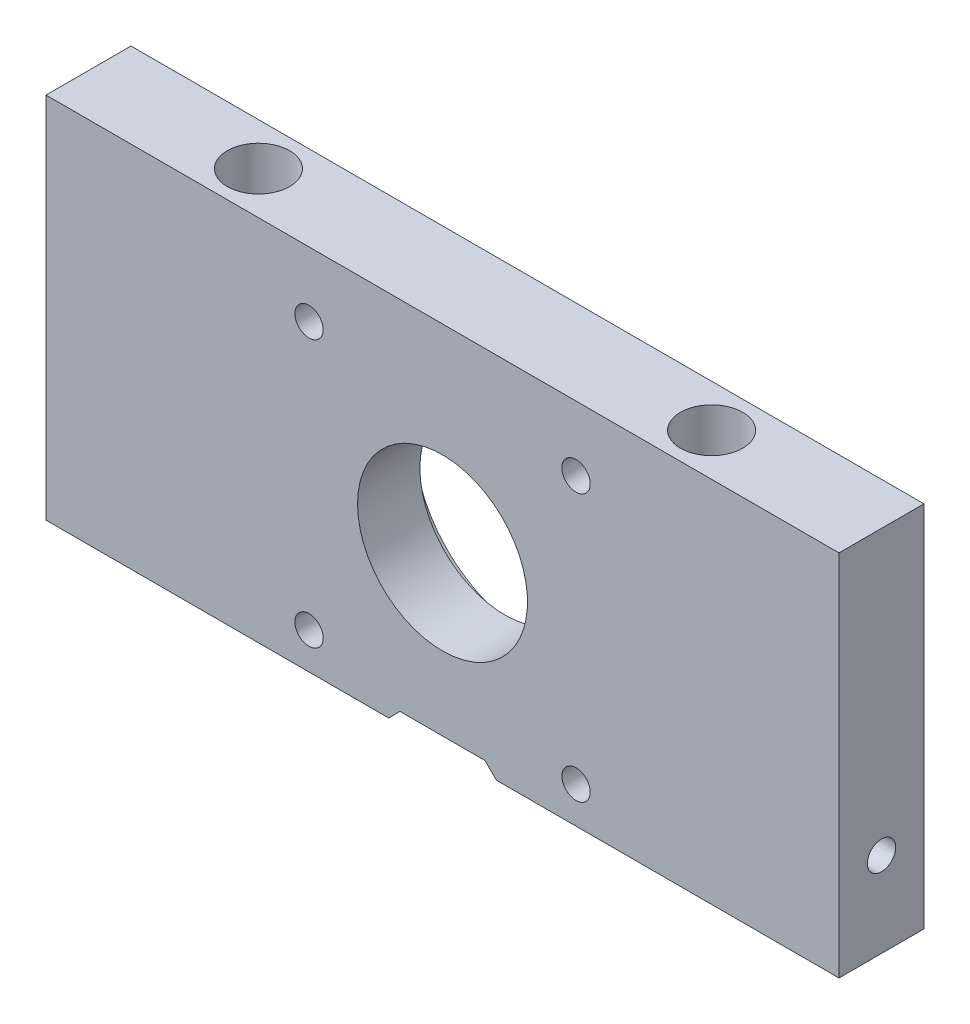
from build123d import *

# Parameters (mm, degrees)
SKETCH1_W                                           = 140
SKETCH1_H                                           = 65
BOSS_EXTRUDE1_DEPTH                                 = 15
SKETCH2_R                                           = 15
SKETCH2_R_2                                         = 2.5
CUT_EXTRUDE2_DEPTH                                  = 27
TAP_DRILL_FOR_M6_TAP1_D                             = 5
TAP_DRILL_FOR_M6_TAP1_DEPTH                         = 15
TAP_DRILL_FOR_M6_TAP1_TIP                           = 1.502151548
CBORE_FOR_M6_HEX_SOCKET_HEAD_CAP_SCREW3_D           = 6.6
CBORE_FOR_M6_HEX_SOCKET_HEAD_CAP_SCREW3_CBORE_D     = 11
CBORE_FOR_M6_HEX_SOCKET_HEAD_CAP_SCREW3_CBORE_DEPTH = 61.4
SKETCH29_W                                          = 35
SKETCH29_H                                          = 2
CUT_EXTRUDE6_DEPTH                                  = 79.620925968
CHAMFER2_SIZE                                       = 10
SKETCH30_R                                          = 20
CUT_EXTRUDE7_DEPTH                                  = 4


with BuildPart() as part:
    # Sketch1 → Boss-Extrude1 (new body)
    with BuildSketch(Plane.XY):
        Rectangle(SKETCH1_W, SKETCH1_H)
    extrude(amount=BOSS_EXTRUDE1_DEPTH)

    # Sketch2 → Cut-Extrude2 (cut)
    with BuildSketch(Plane(origin=(0, 0, 15), x_dir=(-1, 0, 0), z_dir=(0, 0, -1))):
        with Locations(Location((0, -2.5, 0), (0, 0, 180))):
            Circle(SKETCH2_R)
        with Locations(Location((-23.57, 21.07, 0), (0, 0, 180))):
            Circle(SKETCH2_R_2)
        with Locations(Location((23.57, 21.07, 0), (0, 0, 180))):
            Circle(SKETCH2_R_2)
        with Locations(Location((23.57, -26.07, 0), (0, 0, 180))):
            Circle(SKETCH2_R_2)
        with Locations(Location((-23.57, -26.07, 0), (0, 0, 180))):
            Circle(SKETCH2_R_2)
    extrude(amount=CUT_EXTRUDE2_DEPTH, mode=Mode.SUBTRACT)

    # Tap Drill for M6 Tap1
    with Locations(Plane(origin=(70, 0, 0), x_dir=(0, 0, -1), z_dir=(1, 0, 0))):
        with Locations((-7.5, -17.5)):
            Hole(TAP_DRILL_FOR_M6_TAP1_D / 2, depth=TAP_DRILL_FOR_M6_TAP1_DEPTH)
            with Locations((0, 0, -(TAP_DRILL_FOR_M6_TAP1_DEPTH + TAP_DRILL_FOR_M6_TAP1_TIP / 2))):  # 118° drill point
                Cone(0, TAP_DRILL_FOR_M6_TAP1_D / 2, TAP_DRILL_FOR_M6_TAP1_TIP, mode=Mode.SUBTRACT)

    # CBORE for M6 Hex Socket Head Cap Screw3 (through all)
    with Locations(Plane(origin=(0, 32.5, 0), x_dir=(1, 0, 0), z_dir=(0, 1, 0))):
        with Locations((40, -7.5), (-40, -7.5)):
            CounterBoreHole(CBORE_FOR_M6_HEX_SOCKET_HEAD_CAP_SCREW3_D / 2, CBORE_FOR_M6_HEX_SOCKET_HEAD_CAP_SCREW3_CBORE_D / 2, CBORE_FOR_M6_HEX_SOCKET_HEAD_CAP_SCREW3_CBORE_DEPTH)

    # Sketch29 → Cut-Extrude6 (cut, through all)
    with BuildSketch(Plane.XY.offset(15)):
        with Locations((0, -31.5)):
            Rectangle(SKETCH29_W, SKETCH29_H)
    extrude(amount=-CUT_EXTRUDE6_DEPTH, mode=Mode.SUBTRACT)

    # Chamfer2
    # the kernel refuses this chamfer: 10 mm, written as the material it adds along each edge
    with BuildSketch(Plane(origin=(-17.5, -30.5, 15), x_dir=(-0.027495876610591493, -0.9996219169112965, 0), z_dir=(0, 0, -1))) as chamfer2_piece_1_section:
        Polygon((CHAMFER2_SIZE * 0.999621916911, -CHAMFER2_SIZE * 0.0274958766106), (-CHAMFER2_SIZE * 0.0274958766106, -CHAMFER2_SIZE * 0.999621916911), (0, 0), align=None)
    chamfer2_piece_1 = extrude(amount=15, mode=Mode.PRIVATE)
    chamfer2_piece_1 = split(chamfer2_piece_1, bisect_by=Plane(origin=(-12.880949734, -32.5, 7.5), z_dir=(0, 1, 0)), keep=Keep.TOP, mode=Mode.PRIVATE)
    add(chamfer2_piece_1)
    with BuildSketch(Plane(origin=(17.5, -30.5, 15), x_dir=(-0.9996219169112968, 0.027495876610586317, 0), z_dir=(0, 0, -1))) as chamfer2_piece_2_section:
        Polygon((CHAMFER2_SIZE * 0.999621916911, -CHAMFER2_SIZE * 0.0274958766106), (-CHAMFER2_SIZE * 0.0274958766106, -CHAMFER2_SIZE * 0.999621916911), (0, 0), align=None)
    chamfer2_piece_2 = extrude(amount=15, mode=Mode.PRIVATE)
    chamfer2_piece_2 = split(chamfer2_piece_2, bisect_by=Plane(origin=(12.880949734, -32.5, 7.5), z_dir=(0, 1, 0)), keep=Keep.TOP, mode=Mode.PRIVATE)
    add(chamfer2_piece_2)

    # Sketch30 → Cut-Extrude7 (cut)
    with BuildSketch(Plane(origin=(0, 0, 0), x_dir=(-1, 0, 0), z_dir=(0, 0, -1))):
        with Locations((0, -2.5)):
            Circle(SKETCH30_R)
    extrude(amount=-CUT_EXTRUDE7_DEPTH, mode=Mode.SUBTRACT)


solid = part.part
